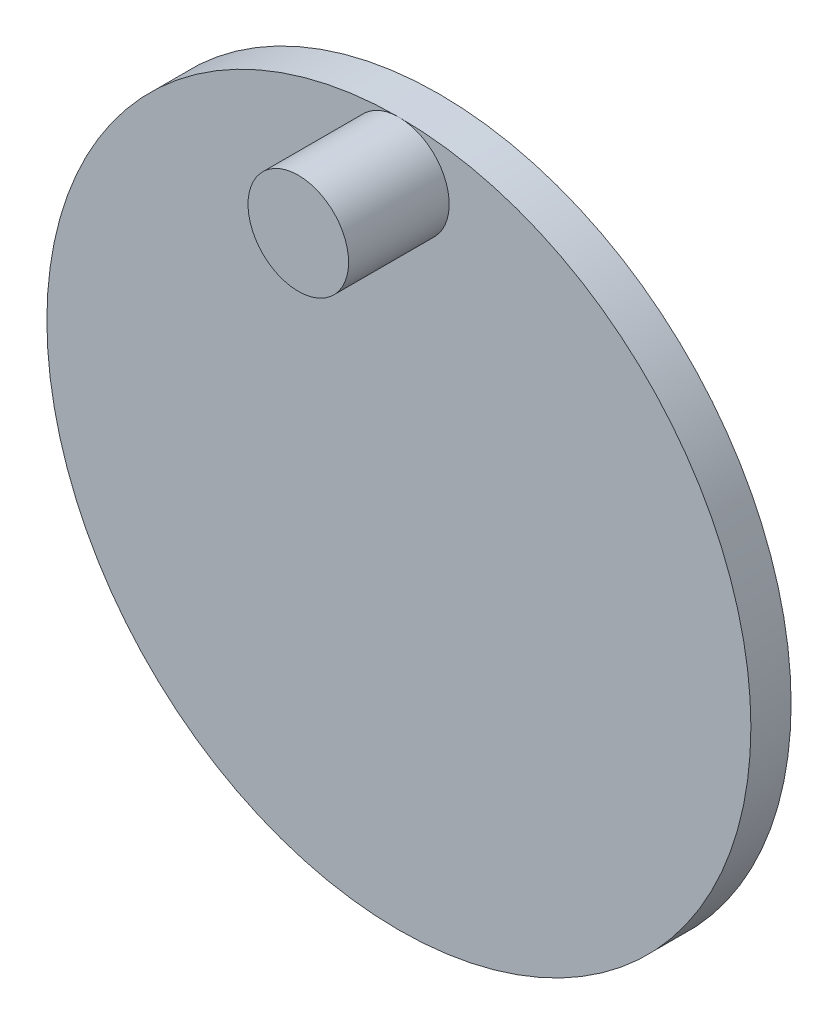
from build123d import *

# Parameters (mm, degrees)
SKETCH1_R           = 17.5
BOSS_EXTRUDE1_DEPTH = 2
SKETCH2_R           = 3.7
BOSS_EXTRUDE3_DEPTH = 8
SKETCH4_R           = 2.5
BOSS_EXTRUDE4_DEPTH = 5


with BuildPart() as part:
    # Sketch1 → Boss-Extrude1 (new body)
    with BuildSketch(Plane.XY):
        Circle(SKETCH1_R)
    extrude(amount=BOSS_EXTRUDE1_DEPTH)

    # Sketch2 → Boss-Extrude3 (add)
    with BuildSketch(Plane(origin=(0, 0, 0), x_dir=(-1, 0, 0), z_dir=(0, 0, -1))):
        Circle(SKETCH2_R)
        with BuildLine():
            Line((-1.85, 1.966596044), (1.85, 1.966596044))
            ThreePointArc((1.85, 1.966596044), (2.7, 0), (1.85, -1.966596044))
            Line((1.85, -1.966596044), (-1.85, -1.966596044))
            ThreePointArc((-1.85, -1.966596044), (-2.7, 0), (-1.85, 1.966596044))
        make_face(mode=Mode.SUBTRACT)
    extrude(amount=BOSS_EXTRUDE3_DEPTH)

    # Sketch4 → Boss-Extrude4 (add)
    with BuildSketch(Plane.XY.offset(2)):
        with Locations((0, 15)):
            Circle(SKETCH4_R)
    extrude(amount=BOSS_EXTRUDE4_DEPTH)


solid = part.part
